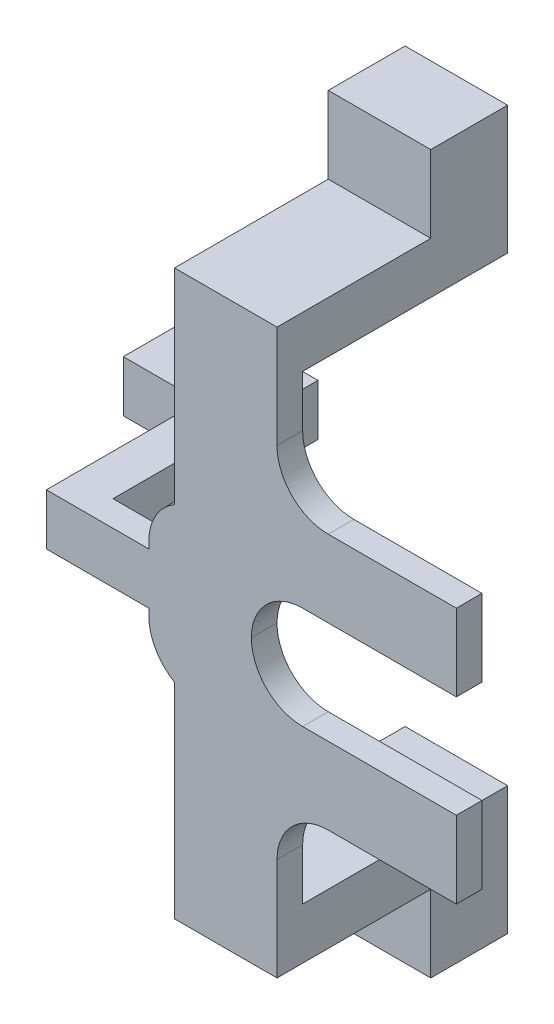
from build123d import *

# Parameters (mm, degrees)
SKETCH_1_W          = 60
SKETCH_1_H          = 30
EXTRUDE_1_DEPTH     = 5
SKETCH_2_W          = 7.4
SKETCH_2_H          = 1.2
SKETCH_2_W_2        = 7
SKETCH_2_H_2        = 0.8
CUT_EXTRUDE_1_DEPTH = 10
SKETCH_3_W          = 40.4
SKETCH_3_H          = 20.4
SKETCH_3_W_2        = 40
SKETCH_3_H_2        = 20
CUT_EXTRUDE_2_DEPTH = 10
SKETCH_5_W          = 20
SKETCH_5_H          = 40
SKETCH_5_H_2        = 10
EXTRUDE_2_DEPTH     = 5
SKETCH_6_W          = 20
SKETCH_6_H          = 10
SKETCH_6_W_2        = 8
EXTRUDE_3_DEPTH     = 40
SKETCH_7_W          = 20
SKETCH_7_H          = 15
SKETCH_7_W_2        = 15
SKETCH_7_H_2        = 10
EXTRUDE_4_DEPTH     = 15
SKETCH_8_W          = 54.931929912
SKETCH_8_H          = 24.682509144
EXTRUDE_5_DEPTH     = 5
SKETCH_9_W          = 40
SKETCH_9_H          = 20
CUT_EXTRUDE_3_DEPTH = 5
SKETCH_10_W         = 35
SKETCH_10_H         = 10
EXTRUDE_6_DEPTH     = 5
FILLET_2_R          = 10
FILLET_3_R          = 10


# Some blends are built 0.0001 mm under size
with BuildPart() as part:
    # 草图1 → 凸台-拉伸1 (new body)
    with BuildSketch(Plane.XY):
        Rectangle(SKETCH_1_W, SKETCH_1_H)
        Polygon((20, 0.4), (20, 10), (-20, 10), (-20, 0.4), (-27, 0.4), (-27, -0.4), (-20, -0.4), (-20, -10), (20, -10), (20, -0.4), (27, -0.4), (27, 0.4), align=None, mode=Mode.SUBTRACT)
    extrude(amount=EXTRUDE_1_DEPTH)

    # 草图2 → 切除-拉伸1 (cut)
    # profile 1 of 2: a face of its own
    with BuildSketch(Plane.XY.offset(5)):
        with Locations((-23.5, 0)):
            Rectangle(SKETCH_2_W, SKETCH_2_H)
        with Locations((-23.5, 0)):
            Rectangle(SKETCH_2_W_2, SKETCH_2_H_2, mode=Mode.SUBTRACT)
    # profile 2 of 2: a face of its own
    with BuildSketch(Plane.XY.offset(5)):
        with Locations((23.5, 0)):
            Rectangle(SKETCH_2_W, SKETCH_2_H)
        with Locations((23.5, 0)):
            Rectangle(SKETCH_2_W_2, SKETCH_2_H_2, mode=Mode.SUBTRACT)
    extrude(amount=-CUT_EXTRUDE_1_DEPTH, mode=Mode.SUBTRACT)

    # 草图3 → 切除-拉伸2 (cut)
    with BuildSketch(Plane.XY.offset(5)):
        Rectangle(SKETCH_3_W, SKETCH_3_H)
        Rectangle(SKETCH_3_W_2, SKETCH_3_H_2, mode=Mode.SUBTRACT)
    extrude(amount=-CUT_EXTRUDE_2_DEPTH, mode=Mode.SUBTRACT)

    # 草图5 → 凸台-拉伸2 (add)
    with BuildSketch(Plane(origin=(0, 0, 0), x_dir=(-1, 0, 0), z_dir=(0, 0, -1))):
        with Locations((15, 35)):
            Rectangle(SKETCH_5_W, SKETCH_5_H)
        with Locations((15, -35)):
            Rectangle(SKETCH_5_W, SKETCH_5_H)
        with Locations((40, 0)):
            Rectangle(SKETCH_5_W, SKETCH_5_H_2)
    extrude(amount=-EXTRUDE_2_DEPTH)

    # 草图6 → 凸台-拉伸3 (add)
    with BuildSketch(Plane(origin=(0, 0, 0), x_dir=(-1, 0, 0), z_dir=(0, 0, -1))):
        with Locations((15, 50)):
            Rectangle(SKETCH_6_W, SKETCH_6_H)
        with Locations((15, -50)):
            Rectangle(SKETCH_6_W, SKETCH_6_H)
        with Locations((46, 0)):
            Rectangle(SKETCH_6_W_2, SKETCH_6_H)
    extrude(amount=EXTRUDE_3_DEPTH)

    # 草图7 → 凸台-拉伸4 (add)
    with BuildSketch(Plane(origin=(0, 0, -40), x_dir=(-1, 0, 0), z_dir=(0, 0, -1))):
        with Locations((15, 62.5)):
            Rectangle(SKETCH_7_W, SKETCH_7_H)
        with Locations((15, -62.5)):
            Rectangle(SKETCH_7_W, SKETCH_7_H)
        with Locations((57.5, 0)):
            Rectangle(SKETCH_7_W_2, SKETCH_7_H_2)
    extrude(amount=-EXTRUDE_4_DEPTH)

    # 草图8 → 凸台-拉伸5 (add)
    with BuildSketch(Plane.XY.offset(5)):
        Rectangle(SKETCH_8_W, SKETCH_8_H)
    extrude(amount=-EXTRUDE_5_DEPTH)

    # 草图9 → 切除-拉伸3 (cut)
    with BuildSketch(Plane.XY.offset(5)):
        with Locations((10, 0)):
            Rectangle(SKETCH_9_W, SKETCH_9_H)
    extrude(amount=-CUT_EXTRUDE_3_DEPTH, mode=Mode.SUBTRACT)

    # 草图10 → 凸台-拉伸6 (add)
    with BuildSketch(Plane.XY.offset(5)):
        with Locations((12.5, 20)):
            Rectangle(SKETCH_10_W, SKETCH_10_H)
        with Locations((12.5, -20)):
            Rectangle(SKETCH_10_W, SKETCH_10_H)
    extrude(amount=-EXTRUDE_6_DEPTH)

    # 圆角2
    fillet_2_edges = [part.edges().sort_by_distance(p)[0] for p in [
        (-10, -10, 2.5),
        (-10, 10, 2.5),
        (-5, -25, 2.5),
        (-5, 25, 2.5),
    ]]
    fillet(fillet_2_edges, radius=FILLET_2_R - 0.0001)  # a hair under: the kernel refuses the full size

    # 圆角3
    # the kernel refuses this fillet: 10 mm, written as the material it takes off along each edge
    with BuildSketch(Plane(origin=(-30, -15, -21.650635095), x_dir=(0, 1, 0), z_dir=(0, 0, 1))) as fillet_3_piece_1:
        with BuildLine():
            CenterArc((8.660254038, -10), FILLET_3_R, 90, 60)
            Line((0, -5), (-0.173205081, -4.9))
            ThreePointArc((-0.173205081, -4.9), (-0.2, -2.5), (-0.2, 0))
            Line((-0.2, 0), (0, 0.2))
            Line((0, 0.2), (8.660254038, 0.2))
            Line((8.660254038, 0.2), (8.660254038, 0))
        make_face()
    extrude(amount=48.301270189, mode=Mode.SUBTRACT)
    with BuildSketch(Plane(origin=(-30, 15, -21.650635095), x_dir=(1, 0, 0), z_dir=(0, 0, 1))) as fillet_3_piece_2:
        with BuildLine():
            CenterArc((10, -8.660254038), FILLET_3_R, 120, 60)
            Line((0, -8.660254038), (-0.2, -8.660254038))
            Line((-0.2, -8.660254038), (-0.2, 0))
            Line((-0.2, 0), (0, 0.2))
            ThreePointArc((0, 0.2), (2.5, 0.2), (4.9, 0.173205081))
            Line((4.9, 0.173205081), (5, 0))
        make_face()
    extrude(amount=48.301270189, mode=Mode.SUBTRACT)


solid = part.part
